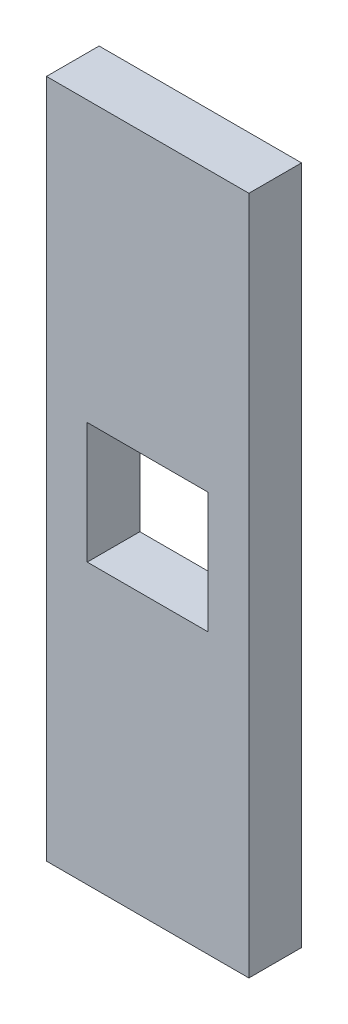
from build123d import *

# Parameters (mm, degrees)
SKETCH1_W           = 11.95
SKETCH1_H           = 11.95
BOSS_EXTRUDE1_DEPTH = 5.2


with BuildPart() as part:
    # Sketch1 → Boss-Extrude1 (new body)
    with BuildSketch(Plane.XY):
        Polygon((0, 67.15), (0, 44.75), (0, 39.55), (0, 27.6), (0, 22.4), (0, 0), (20, 0), (20, 22.4), (20, 27.6), (20, 39.55), (20, 44.75), (20, 67.15), align=None)
        with Locations((10, 33.575)):
            Rectangle(SKETCH1_W, SKETCH1_H, mode=Mode.SUBTRACT)
    extrude(amount=BOSS_EXTRUDE1_DEPTH)


solid = part.part
